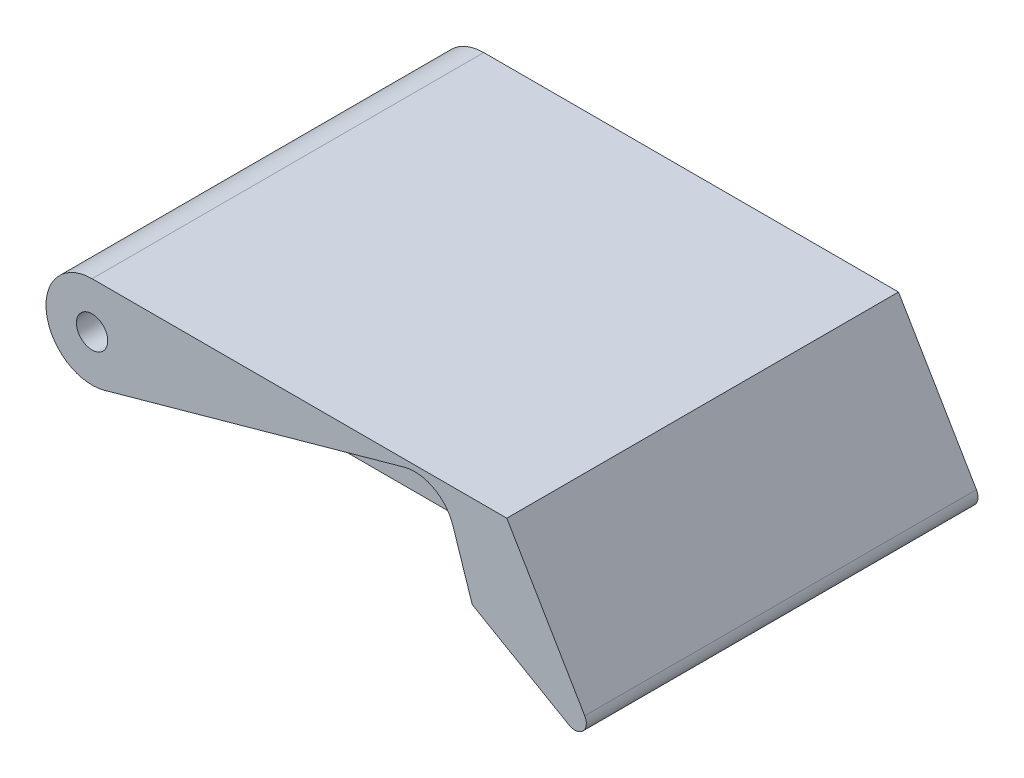
from build123d import *

# Parameters (mm, degrees)
BOSS_EXTRUDE1_DEPTH = 26.9875
SKETCH2_R           = 2.159
SKETCH2_R_2         = 1.905
CUT_EXTRUDE1_DEPTH  = 91.763896577
CUT_EXTRUDE2_DEPTH  = 9.525
FILLET1_R           = 1.5875


with BuildPart() as part:
    # Sketch1 → Boss-Extrude1 (new, symmetric)
    with BuildSketch(Plane.XY):
        with BuildLine():
            Line((0, 6.35), (57.15, 6.35))
            Line((57.15, 6.35), (70.947506935, -17.065625))
            Line((70.947506935, -17.065625), (52.3875, -6.35))
            Line((52.3875, -6.35), (0, -6.35))
            ThreePointArc((0, -6.35), (-6.35, 0), (0, 6.35))
        make_face()
    extrude(amount=BOSS_EXTRUDE1_DEPTH, both=True)

    # Sketch2 → Cut-Extrude1 (cut, through all)
    with BuildSketch(Plane.XY.offset(26.9875)):
        Circle(SKETCH2_R)
        with Locations((44.45, 0)):
            Circle(SKETCH2_R_2)
    extrude(amount=-CUT_EXTRUDE1_DEPTH, mode=Mode.SUBTRACT)

    # Sketch3 → Cut-Extrude2 (cut)
    with BuildSketch(Plane.XY.offset(26.9875)):
        with BuildLine():
            Line((1.700892857, -6.117962364), (42.96171875, 5.353217069))
            ThreePointArc((42.96171875, 5.353217069), (47.069524942, 4.900000321), (49.728113691, 1.735923364))
            Line((49.728113691, 1.735923364), (52.3875, -6.35))
            Line((52.3875, -6.35), (0, -6.35))
            ThreePointArc((0, -6.35), (0.858323653, -6.291723175), (1.700892857, -6.117962364))
        make_face()
    cut_extrude2 = extrude(amount=-CUT_EXTRUDE2_DEPTH, mode=Mode.SUBTRACT)

    # Mirror1: Cut-Extrude2 across plane
    add(cut_extrude2.mirror(Plane.XY), mode=Mode.SUBTRACT)

    # Fillet1
    fillet1_edges = [part.edges().sort_by_distance(p)[0] for p in [
        (70.947506935, -17.065625, 0),
    ]]
    fillet(fillet1_edges, radius=FILLET1_R)


solid = part.part
